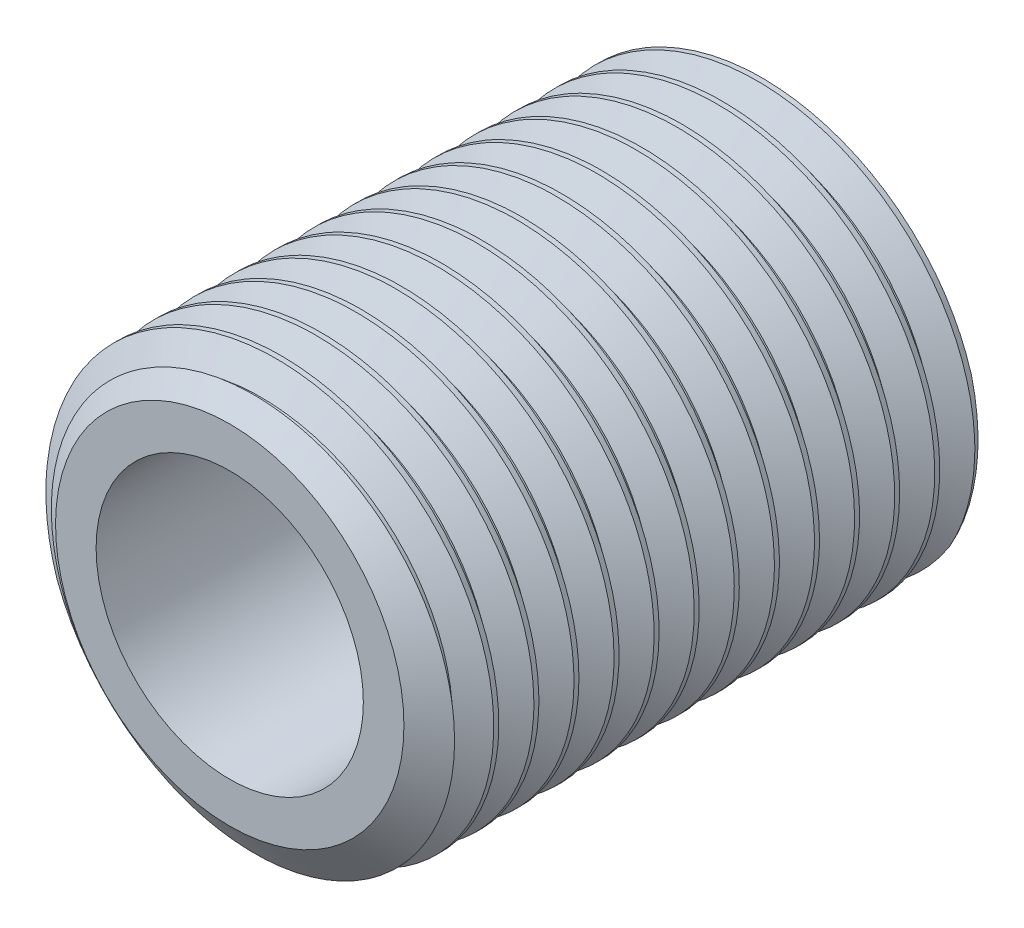
from build123d import *

# Parameters (mm, degrees)
SKETCH1_R          = 4
EXTRUDE1_DEPTH     = 10
CUT_SWEEP1_PITCH   = 0.75
SKETCH11_R         = 2.5
CUT_EXTRUDE3_DEPTH = 12.48912545


with BuildPart() as part:
    # Sketch1 → Extrude1 (new body)
    with BuildSketch(Plane.XY):
        Circle(SKETCH1_R)
    extrude(amount=-EXTRUDE1_DEPTH)

    # Cut-Sweep1: arcs per turn and ends read off the stored shape
    # Cut-Sweep1: the profile of Sketch3 profile screwed along a right-hand helix through 16 turns, 6 arcs to a turn; built about Z, then put on its axis
    cut_sweep1_z = Axis((0, 0, 0), (0, 0, 1))
    cut_sweep1_corners = [(4.0003, 0, -1.406423205), (3.51286071, 0, -1.125), (3.51286071, 0, -1.03125), (4.0003, 0, -0.749826795)]
    with BuildLine(mode=Mode.PRIVATE) as cut_sweep1_profile:
        Line(cut_sweep1_corners[0], cut_sweep1_corners[1])
        Line(cut_sweep1_corners[1], cut_sweep1_corners[2])
        Line(cut_sweep1_corners[2], cut_sweep1_corners[3])
        Line(cut_sweep1_corners[3], cut_sweep1_corners[0])
    cut_sweep1_cap = Face(cut_sweep1_profile.wire())
    cut_sweep1_turn_angles = [0, 30, 60, 90, 120, 150, 180, 210, 240, 270, 300, 330, 360]
    cut_sweep1_turn_weights = [1, 0.8660254037844387, 1, 0.8660254037844387, 1, 0.8660254037844387, 1, 0.8660254037844387, 1, 0.8660254037844387, 1, 0.8660254037844387, 1]
    cut_sweep1_turn_rails = [Edge.make_bspline([Vector(p[0], p[1], 0).rotate(cut_sweep1_z, cut_sweep1_turn_angles[k]) / cut_sweep1_turn_weights[k] + Vector(0, 0, p[2] + CUT_SWEEP1_PITCH * cut_sweep1_turn_angles[k] / 360) for k in range(13)], [0, 0, 0, 1, 1, 2, 2, 3, 3, 4, 4, 5, 5, 6, 6, 6], 2, cut_sweep1_turn_weights) for p in cut_sweep1_corners]
    cut_sweep1_turn_sides = [Face.make_surface_from_curves(cut_sweep1_turn_rails[p[0]], cut_sweep1_turn_rails[p[1]]) for p in [(0, 1), (1, 2), (2, 3), (3, 0)]]
    cut_sweep1 = Plane(origin=(0, 0, 0), x_dir=(0, 1, 0), z_dir=(0, 0, -1)) * Solid(Shell([*[p.moved(Location((0, 0, CUT_SWEEP1_PITCH * i))) for i in range(16) for p in cut_sweep1_turn_sides], cut_sweep1_cap, cut_sweep1_cap.rotate(cut_sweep1_z, 5760).moved(Location((0, 0, CUT_SWEEP1_PITCH * 5760 / 360)))]))
    add(cut_sweep1, mode=Mode.SUBTRACT)

    # Sketch11 → Cut-Extrude3 (cut, through all)
    with BuildSketch(Plane(origin=(0, 0, -10), x_dir=(-1, 0, 0), z_dir=(0, 0, -1))):
        Circle(SKETCH11_R)
    extrude(amount=-CUT_EXTRUDE3_DEPTH, mode=Mode.SUBTRACT)

    # Sketch4 → Cut-Revolve1 (revolve, cut)
    with BuildSketch(Plane(origin=(0, 0, 0), x_dir=(0, 0, -1), z_dir=(1, 0, 0)), mode=Mode.PRIVATE) as cut_revolve1_sk:
        Polygon((0.518951317, 4), (0, 3.25886071), (0, 4), align=None)
    revolve(cut_revolve1_sk.sketch.rotate(Axis((0, 0, 0), (0, 0, -1)), 265.573608421), axis=Axis((0, 0, 0), (0, 0, -1)), mode=Mode.SUBTRACT)


solid = part.part
